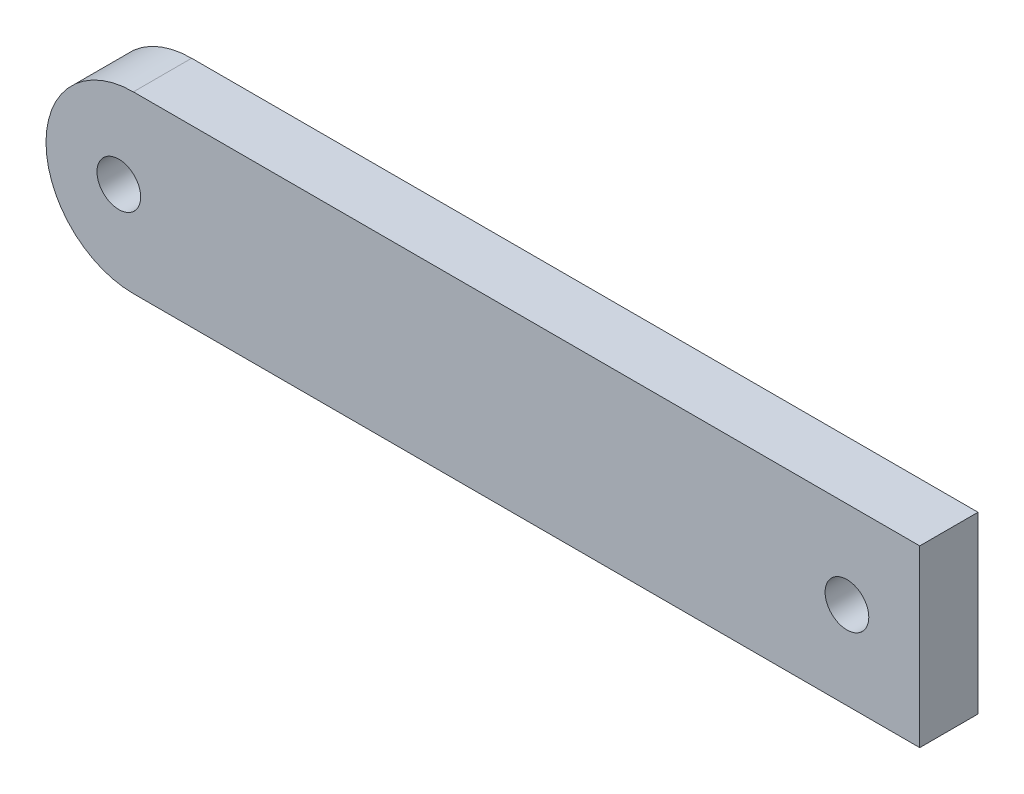
from build123d import *

# Parameters (mm, degrees)
SKETCH_1_W      = 60
SKETCH_1_H      = 12
SKETCH_1_R      = 1.5
EXTRUDE_1_DEPTH = 4
FILLET_1_R      = 6


with BuildPart() as part:
    # 草图1 → 凸台-拉伸1 (new body)
    with BuildSketch(Plane.XY):
        with Locations((5, 0)):
            Rectangle(SKETCH_1_W, SKETCH_1_H)
        with Locations((-20, 0)):
            Circle(SKETCH_1_R, mode=Mode.SUBTRACT)
        with Locations((30, 0)):
            Circle(SKETCH_1_R, mode=Mode.SUBTRACT)
    extrude(amount=EXTRUDE_1_DEPTH)

    # 圆角1
    fillet_1_edges = [part.edges().sort_by_distance(p)[0] for p in [
        (-25, -6, 2),
        (-25, 6, 2),
    ]]
    fillet(fillet_1_edges, radius=FILLET_1_R - 0.0001)  # a hair under: the kernel refuses the full size


solid = part.part
